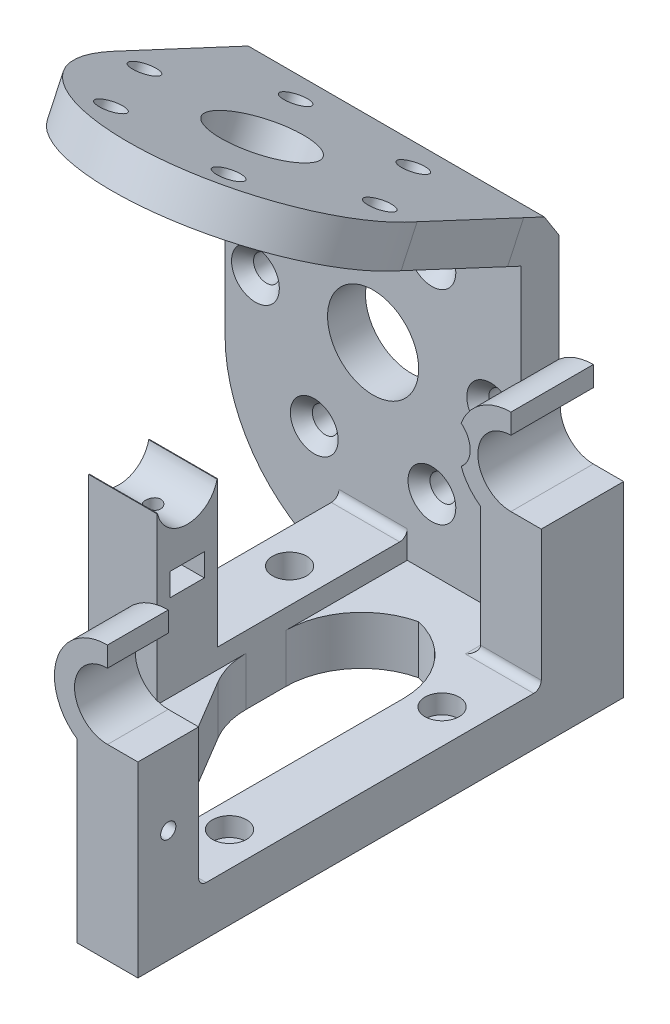
from build123d import *

# Parameters (mm, degrees)
SKETCH5_R                                       = 19.5
SKETCH5_R_2                                     = 1.5
SKETCH5_R_3                                     = 6
BOSS_EXTRUDE1_DEPTH                             = 5
CSK_FOR_M3_FLAT_HEAD_MACHINE_SCREW1_D           = 3.4
CSK_FOR_M3_FLAT_HEAD_MACHINE_SCREW1_CSINK_D     = 6.3
CSK_FOR_M3_FLAT_HEAD_MACHINE_SCREW1_CSINK_ANGLE = 90
BOSS_EXTRUDE2_START                             = -5
BOSS_EXTRUDE2_DEPTH                             = 5
SKETCH9_W                                       = 9
SKETCH9_H                                       = 5
BOSS_EXTRUDE3_DEPTH                             = 32.98166783
SKETCH10_W                                      = 9
SKETCH10_H                                      = 8
BOSS_EXTRUDE4_DEPTH                             = 24
CUT_EXTRUDE1_DEPTH                              = 20
SKETCH12_R                                      = 1
CUT_EXTRUDE2_DEPTH                              = 16
CUT_EXTRUDE3_START                              = -9
SKETCH13_W                                      = 4.5
SKETCH13_H                                      = 3
CUT_EXTRUDE3_DEPTH                              = 9
BOSS_EXTRUDE5_DEPTH                             = 2.4
SKETCH15_W                                      = 8
SKETCH15_H                                      = 26.6
BOSS_EXTRUDE6_DEPTH                             = 8
CUT_EXTRUDE4_REACH                              = 76.201
CUT_EXTRUDE5_REACH                              = 83.567
SKETCH17_W                                      = 8
SKETCH17_H                                      = 3
BOSS_EXTRUDE7_DEPTH                             = 2.4
FILLET1_R                                       = 10
FILLET2_R                                       = 1
FILLET3_R                                       = 1
BOSS_EXTRUDE8_START                             = -5.858134929
BOSS_EXTRUDE8_DEPTH                             = 5.858134929
BOSS_EXTRUDE9_DEPTH                             = 8
CUT_EXTRUDE9_REACH                              = 77.385
SKETCH26_R                                      = 4.35
BOSS_EXTRUDE10_START                            = 4
BOSS_EXTRUDE10_DEPTH                            = 4
SKETCH28_R                                      = 1
CUT_EXTRUDE10_DEPTH                             = 83.645869552
SKETCH29_R                                      = 2.25
CUT_EXTRUDE11_DEPTH                             = 2.5
SKETCH30_R                                      = 1
CUT_EXTRUDE12_DEPTH                             = 82.352195754
SKETCH31_R                                      = 2.25
CUT_EXTRUDE13_DEPTH                             = 5
CIRPATTERN1_START                               = 14.620394441
CIRPATTERN1_OUTLINE_R                           = 19.5
CIRPATTERN1_OUTLINE_R_2                         = 1.7
CIRPATTERN1_OUTLINE_R_3                         = 6
CIRPATTERN1_DEPTH                               = 5
BOSS_EXTRUDE11_START                            = -5
SKETCH32_R                                      = 4.35
BOSS_EXTRUDE11_DEPTH                            = 5
CUT_EXTRUDE14_REACH                             = 83.129
FILLET5_R                                       = 20
BOSS_EXTRUDE12_DEPTH                            = 39
BOSS_EXTRUDE13_START                            = -5
BOSS_EXTRUDE13_DEPTH                            = 5
BOSS_EXTRUDE14_START                            = -5
BOSS_EXTRUDE14_DEPTH                            = 5
SKETCH37_W                                      = 24.556153246
SKETCH37_H                                      = 66.139023171
CUT_EXTRUDE15_DEPTH                             = 24.65
SKETCH38_R                                      = 1
CUT_EXTRUDE16_DEPTH                             = 31


with BuildPart() as part:
    # Sketch5 → Boss-Extrude1 (new body)
    with BuildSketch(Plane.XY):
        Circle(SKETCH5_R)
        with Locations((-7.75, 13.423393759)):
            Circle(SKETCH5_R_2, mode=Mode.SUBTRACT)
        Circle(SKETCH5_R_3, mode=Mode.SUBTRACT)
        with Locations((7.75, 13.423393759)):
            Circle(SKETCH5_R_2, mode=Mode.SUBTRACT)
        with Locations((15.5, 0)):
            Circle(SKETCH5_R_2, mode=Mode.SUBTRACT)
        with Locations((7.75, -13.423393759)):
            Circle(SKETCH5_R_2, mode=Mode.SUBTRACT)
        with Locations((-7.75, -13.423393759)):
            Circle(SKETCH5_R_2, mode=Mode.SUBTRACT)
        with Locations((-15.5, 0)):
            Circle(SKETCH5_R_2, mode=Mode.SUBTRACT)
    extrude(amount=BOSS_EXTRUDE1_DEPTH)

    # CSK for M3 Flat Head Machine Screw1 (through all)
    with Locations(Plane.XY.offset(5)):
        with Locations((-15.5, 0), (-7.75, 13.423393759), (7.75, 13.423393759), (15.5, 0), (7.75, -13.423393759), (-7.75, -13.423393759)):
            CounterSinkHole(CSK_FOR_M3_FLAT_HEAD_MACHINE_SCREW1_D / 2, CSK_FOR_M3_FLAT_HEAD_MACHINE_SCREW1_CSINK_D / 2, counter_sink_angle=CSK_FOR_M3_FLAT_HEAD_MACHINE_SCREW1_CSINK_ANGLE)

    # Sketch8 → Boss-Extrude2 (add)
    with BuildSketch(Plane.XY.offset(5).offset(BOSS_EXTRUDE2_START)):
        with BuildLine():
            Line((-19.5, 0), (-19.5, -25))
            Line((-19.5, -25), (19.5, -25))
            Line((19.5, -25), (19.5, 0))
            ThreePointArc((19.5, 0), (0, -19.5), (-19.5, 0))
        make_face()
    extrude(amount=BOSS_EXTRUDE2_DEPTH)

    # Sketch9 → Boss-Extrude3 (add)
    with BuildSketch(Plane.XY.offset(5)):
        with Locations((0, -22.5)):
            Rectangle(SKETCH9_W, SKETCH9_H)
    extrude(amount=BOSS_EXTRUDE3_DEPTH)

    # Sketch10 → Boss-Extrude4 (add)
    with BuildSketch(Plane(origin=(0.371235249, -20, 0), x_dir=(1, 0, 0), z_dir=(0, 1, 0))):
        with Locations((-0.371235249, -33.98166783)):
            Rectangle(SKETCH10_W, SKETCH10_H)
    extrude(amount=BOSS_EXTRUDE4_DEPTH)

    # Sketch11 → Cut-Extrude1 (cut)
    with BuildSketch(Plane.ZY.offset(4.5)):
        with BuildLine():
            Line((29.98166783, 0), (27.136883472, 2.082164772))
            Line((27.136883472, 2.082164772), (27.357366889, 4.848229459))
            Line((27.357366889, 4.848229459), (32.749188635, 5.469591817))
            Line((32.749188635, 5.469591817), (41.448261638, 5.028624983))
            Line((41.448261638, 5.028624983), (40.823718291, 2.383004911))
            Line((40.823718291, 2.383004911), (37.98166783, 0))
            Line((37.98166783, 0), (37.98166783, -0.8))
            Line((37.98166783, -0.8), (37.900851418, -0.8))
            ThreePointArc((37.900851418, -0.8), (33.98166783, -4), (30.062484242, -0.8))
            Line((30.062484242, -0.8), (29.98166783, -0.8))
            Line((29.98166783, -0.8), (29.98166783, 0))
        make_face()
    extrude(amount=-CUT_EXTRUDE1_DEPTH, mode=Mode.SUBTRACT)

    # Sketch12 → Cut-Extrude2 (cut)
    with BuildSketch(Plane(origin=(0, -0.8, 0), x_dir=(1, 0, 0), z_dir=(0, 1, 0))):
        with Locations(Location((0, -33.98166783, 0), (0, 0, 180))):
            Circle(SKETCH12_R)
    extrude(amount=-CUT_EXTRUDE2_DEPTH, mode=Mode.SUBTRACT)

    # Sketch13 → Cut-Extrude3 (cut)
    with BuildSketch(Plane.ZY.offset(4.5).offset(CUT_EXTRUDE3_START)):
        with Locations((33.98166783, -9.74430731)):
            Rectangle(SKETCH13_W, SKETCH13_H)
    extrude(amount=CUT_EXTRUDE3_DEPTH, mode=Mode.SUBTRACT)

    # Sketch14 → Boss-Extrude5 (add)
    with BuildSketch(Plane.XZ.offset(25)):
        Polygon((4.5, 5), (28.014992407, 5), (28.014992407, 12.492055485), (28.014992407, 64), (20.014992407, 64), (20.014992407, 11), (4.5, 11), align=None)
    extrude(amount=-BOSS_EXTRUDE5_DEPTH)

    # Sketch15 → Boss-Extrude6 (add)
    with BuildSketch(Plane(origin=(28.014992407, 0, 0), x_dir=(0, 0, -1), z_dir=(1, 0, 0))):
        with Locations((-60, -9.3)):
            Rectangle(SKETCH15_W, SKETCH15_H)
        with Locations((-9, -9.3)):
            Rectangle(SKETCH15_W, SKETCH15_H)
    extrude(amount=-BOSS_EXTRUDE6_DEPTH)

    # Cut-Extrude4: up to this face of the body (flat: up to its plane)
    cut_extrude4_end = Plane(part.part.faces().sort_by_distance((12, -22.008286387, 5))[0])
    # Sketch16 → Cut-Extrude4 (cut, up to the picked face)
    with BuildSketch(Plane.XY.offset(64), mode=Mode.PRIVATE) as cut_extrude4_sk1:
        with BuildLine():
            Line((20.014992407, -1.0579315), (20.157430879, -1.0579315))
            ThreePointArc((20.157430879, -1.0579315), (24.014992407, -4), (27.872553935, -1.0579315))
            Line((27.872553935, -1.0579315), (28.014992407, -1.0579315))
            Line((28.014992407, -1.0579315), (30.979685938, 0.908889408))
            Line((30.979685938, 0.908889408), (30.041869507, 7.8055779))
            Line((30.041869507, 7.8055779), (20.014992407, 9.247594016))
            Line((20.014992407, 9.247594016), (20.014992407, -1.0579315))
        make_face()
    cut_extrude4_tool1 = split(extrude(cut_extrude4_sk1.sketch, amount=-CUT_EXTRUDE4_REACH, mode=Mode.PRIVATE), bisect_by=cut_extrude4_end, keep=Keep.BOTH, mode=Mode.PRIVATE)
    add(cut_extrude4_tool1.solids().sort_by(Axis((24.887523, 2.893806, 64), (0, 0, -1)))[0], mode=Mode.SUBTRACT)

    # Cut-Extrude5: up to this face of the body (flat: up to its plane)
    cut_extrude5_end = Plane(part.part.faces().sort_by_distance((20.086211643, -1.0579315, 9))[0])
    # Sketch17 → Cut-Extrude5 (cut, up to the picked face)
    with BuildSketch(Plane(origin=(0, -22.6, 0), x_dir=(1, 0, 0), z_dir=(0, 1, 0)), mode=Mode.PRIVATE) as cut_extrude5_sk1:
        with Locations((24.014992407, -12.358134929)):
            Rectangle(SKETCH17_W, SKETCH17_H)
    cut_extrude5_tool1 = split(extrude(cut_extrude5_sk1.sketch, amount=CUT_EXTRUDE5_REACH, mode=Mode.PRIVATE), bisect_by=cut_extrude5_end, keep=Keep.BOTH, mode=Mode.PRIVATE)
    add(cut_extrude5_tool1.solids().sort_by(Axis((24.014992, -22.6, 12.358135), (0, 1, 0)))[0], mode=Mode.SUBTRACT)

    # Sketch20 → Boss-Extrude7 (add)
    with BuildSketch(Plane(origin=(0, -22.6, 0), x_dir=(1, 0, 0), z_dir=(0, 1, 0))):
        Polygon((20.014992407, -64), (4.5, -37.98166783), (4.5, -28.98166783), (20.014992407, -55), align=None)
    extrude(amount=-BOSS_EXTRUDE7_DEPTH)

    # Fillet1
    # the kernel refuses this fillet: 10 mm, written as the material it adds along each edge
    with BuildSketch(Plane(origin=(4.5, -25, 11), x_dir=(0, 0, 1), z_dir=(0, 1, 0)), Plane(origin=(20.014992407, -25, 11), x_dir=(-1, 0, 0), z_dir=(0, 1, 0))) as fillet1_piece_1:
        with BuildLine():
            CenterArc((FILLET1_R, FILLET1_R), FILLET1_R, 180, 90)
            Line((0, FILLET1_R), (0, 0))
            Line((0, 0), (FILLET1_R, 0))
        make_face()
    extrude(amount=2.4)
    with BuildSketch(Plane(origin=(4.5, -22.6, 28.98166783), x_dir=(0, 0, -1), z_dir=(0, -1, 0))) as fillet1_piece_2:
        with BuildLine():
            CenterArc((FILLET1_R * 0.275521450238, FILLET1_R), FILLET1_R, 239.191952284, 30.808047716)
            Line((-FILLET1_R * 0.236642058357, FILLET1_R * 0.141112032647), (0, 0))
            Line((0, 0), (FILLET1_R * 0.275521450238, 0))
        make_face()
    extrude(amount=2.4)

    # Fillet2
    fillet2_edges = [part.edges().sort_by_distance(p)[0] for p in [
        (20.014992407, -23.8, 55),
    ]]
    fillet(fillet2_edges, radius=FILLET2_R)

    # Fillet3
    # the kernel refuses this fillet: 1 mm, written as the material it adds along each edge
    with BuildSketch(Plane(origin=(28.014992407, -22.6, 56), x_dir=(0, 0, -1), z_dir=(-1, 0, 0))) as fillet3_piece_1:
        with BuildLine():
            CenterArc((FILLET3_R, -FILLET3_R), FILLET3_R, 90, 90)
            Line((0, -FILLET3_R), (0, 0))
            Line((0, 0), (FILLET3_R, 0))
        make_face()
    extrude(amount=8)
    with BuildSketch(Plane(origin=(20.014992407, -22.6, 5), x_dir=(-1, 0, 0), z_dir=(0, 0, 1))) as fillet3_piece_2:
        with BuildLine():
            CenterArc((FILLET3_R, -FILLET3_R), FILLET3_R, 90, 90)
            Line((0, -FILLET3_R), (0, 0))
            Line((0, 0), (FILLET3_R, 0))
        make_face()
    extrude(amount=5.858134929)
    with BuildSketch(Plane(origin=(28.014992407, -22.6, 10.858134929), x_dir=(0, 0, 1), z_dir=(-1, 0, 0))) as fillet3_piece_3:
        with BuildLine():
            CenterArc((FILLET3_R, FILLET3_R), FILLET3_R, 180, 90)
            Line((0, FILLET3_R), (0, 0))
            Line((0, 0), (FILLET3_R, 0))
        make_face()
    extrude(amount=8)
    with BuildSketch(Plane(origin=(4.5, -20, 5), x_dir=(0, 1, 0), z_dir=(-1, 0, 0))) as fillet3_piece_4:
        with BuildLine():
            CenterArc((FILLET3_R, -FILLET3_R), FILLET3_R, 90, 90)
            Line((0, -FILLET3_R), (0, 0))
            Line((0, 0), (FILLET3_R, 0))
        make_face()
    extrude(amount=9)
    with BuildSketch(Plane(origin=(20.014992407, -22.6, 5), x_dir=(-1, 0, 0), z_dir=(0, 0, 1))) as fillet3_piece_5a_section:
        with BuildLine():
            CenterArc((FILLET3_R, -FILLET3_R), FILLET3_R, 90, 90)
            Line((0, -FILLET3_R), (0, 0))
            Line((0, 0), (FILLET3_R, 0))
        make_face()
    fillet3_piece_5a = extrude(amount=8.358134929, mode=Mode.PRIVATE)
    fillet3_piece_5a = split(fillet3_piece_5a, bisect_by=Plane(origin=(20.014992407, -22.6, 10.858134929), z_dir=(0, 0, 1)), keep=Keep.TOP, mode=Mode.PRIVATE)
    with BuildSketch(Plane(origin=(28.014992407, -22.6, 10.858134929), x_dir=(0, 0, 1), z_dir=(-1, 0, 0))) as fillet3_piece_5b_section:
        with BuildLine():
            CenterArc((FILLET3_R, FILLET3_R), FILLET3_R, 180, 90)
            Line((0, FILLET3_R), (0, 0))
            Line((0, 0), (FILLET3_R, 0))
        make_face()
    fillet3_piece_5b = extrude(amount=10.5, mode=Mode.PRIVATE)
    fillet3_piece_5b = split(fillet3_piece_5b, bisect_by=Plane(origin=(20.014992407, -22.6, 10.858134929), z_dir=(-1, 0, 0)), keep=Keep.TOP, mode=Mode.PRIVATE)
    fillet3_piece_5 = fillet3_piece_5a & fillet3_piece_5b
    add(fillet3_piece_5)

    # Sketch24 → Boss-Extrude8 (add)
    with BuildSketch(Plane(origin=(0, 0, 5), x_dir=(-1, 0, 0), z_dir=(0, 0, -1)).offset(BOSS_EXTRUDE8_START)):
        with BuildLine():
            Line((-20.014992407, -5.744562647), (-20.014992407, -1.0579315))
            Line((-20.014992407, -1.0579315), (-20.157430879, -1.0579315))
            ThreePointArc((-20.157430879, -1.0579315), (-24.014992407, 4), (-27.872553935, -1.0579315))
            Line((-27.872553935, -1.0579315), (-28.014992407, -1.0579315))
            Line((-28.014992407, -1.0579315), (-28.014992407, -5.744562647))
            ThreePointArc((-28.014992407, -5.744562647), (-28.312909665, 5.525206534), (-17.462867029, 2.463666582))
            ThreePointArc((-17.462867029, 2.463666582), (-18.65, 0), (-17.462867029, -2.463666582))
            ThreePointArc((-17.462867029, -2.463666582), (-18.489785873, -4.297917258), (-20.014992407, -5.744562647))
        make_face()
    extrude(amount=BOSS_EXTRUDE8_DEPTH)

    # Sketch25 → Boss-Extrude9 (add)
    with BuildSketch(Plane.XY.offset(64)):
        with BuildLine():
            Line((20.014992407, -5.744562647), (20.014992407, -1.0579315))
            Line((20.014992407, -1.0579315), (20.157430879, -1.0579315))
            ThreePointArc((20.157430879, -1.0579315), (24.014992407, 4), (27.872553935, -1.0579315))
            Line((27.872553935, -1.0579315), (28.014992407, -1.0579315))
            Line((28.014992407, -1.0579315), (28.014992407, -5.744562647))
            ThreePointArc((28.014992407, -5.744562647), (24.014992407, 7), (20.014992407, -5.744562647))
        make_face()
    extrude(amount=-BOSS_EXTRUDE9_DEPTH)

    # Cut-Extrude9: up to this face of the body (flat: up to its plane)
    cut_extrude9_end = Plane(part.part.faces().sort_by_distance((24.401043924, -10.02174873, 5))[0])
    # Sketch26 → Cut-Extrude9 (cut, up to the picked face)
    with BuildSketch(Plane.XY.offset(64), mode=Mode.PRIVATE) as cut_extrude9_sk1:
        with Locations((24.014992407, 0)):
            Circle(SKETCH26_R)
    cut_extrude9_tool1 = split(extrude(cut_extrude9_sk1.sketch, amount=-CUT_EXTRUDE9_REACH, mode=Mode.PRIVATE), bisect_by=cut_extrude9_end, keep=Keep.BOTH, mode=Mode.PRIVATE)
    add(cut_extrude9_tool1.solids().sort_by(Axis((24.014992, 0, 64), (0, 0, -1)))[0], mode=Mode.SUBTRACT)

    # Sketch27 → Boss-Extrude10 (add)
    with BuildSketch(Plane.XZ.offset(25).offset(BOSS_EXTRUDE10_START)):
        Polygon((19.5, 0), (19.5, 5), (28.014992407, 5), (28.014992407, 64), (20.014992407, 64), (4.5, 37.98166783), (-4.5, 37.98166783), (-4.5, 5), (-19.5, 5), (-19.5, 0), align=None)
        with BuildLine():
            Line((4.5, 26.226453328), (4.5, 21))
            ThreePointArc((4.5, 21), (6.67615702, 14.772040381), (12.257496204, 11.25468437))
            ThreePointArc((12.257496204, 11.25468437), (17.838835387, 14.772040381), (20.014992407, 21))
            Line((20.014992407, 21), (20.014992407, 51.370518524))
            ThreePointArc((20.014992407, 51.370518524), (19.280616232, 52.334595276), (18.15610444, 51.882682032))
            Line((18.15610444, 51.882682032), (5.911120326, 31.348088414))
            ThreePointArc((5.911120326, 31.348088414), (4.85923248, 28.882691576), (4.5, 26.226453328))
        make_face(mode=Mode.SUBTRACT)
    extrude(amount=-BOSS_EXTRUDE10_DEPTH)

    # Sketch28 → Cut-Extrude10 (cut, through all)
    with BuildSketch(Plane(origin=(0, -22.6, 0), x_dir=(1, 0, 0), z_dir=(0, 1, 0))):
        with Locations(Location((23.514992407, -19.429067464, 0), (0, 0, 270))):
            Circle(SKETCH28_R)
        with Locations(Location((23.514992407, -47.429067464, 0), (0, 0, 270))):
            Circle(SKETCH28_R)
    extrude(amount=-CUT_EXTRUDE10_DEPTH, mode=Mode.SUBTRACT)

    # Sketch29 → Cut-Extrude11 (cut)
    with BuildSketch(Plane(origin=(0, -22.6, 0), x_dir=(1, 0, 0), z_dir=(0, 1, 0))):
        with Locations(Location((23.514992407, -19.429067464, 0), (0, 0, 270))):
            Circle(SKETCH29_R)
        with Locations(Location((23.514992407, -47.429067464, 0), (0, 0, 270))):
            Circle(SKETCH29_R)
    extrude(amount=-CUT_EXTRUDE11_DEPTH, mode=Mode.SUBTRACT)

    # Sketch30 → Cut-Extrude12 (cut, through all)
    with BuildSketch(Plane(origin=(0, -20, 0), x_dir=(1, 0, 0), z_dir=(0, 1, 0))):
        with Locations(Location((0, -16, 0), (0, 0, 270))):
            Circle(SKETCH30_R)
    extrude(amount=-CUT_EXTRUDE12_DEPTH, mode=Mode.SUBTRACT)

    # Sketch31 → Cut-Extrude13 (cut)
    with BuildSketch(Plane(origin=(0, -20, 0), x_dir=(1, 0, 0), z_dir=(0, 1, 0))):
        with Locations(Location((0, -16, 0), (0, 0, 270))):
            Circle(SKETCH31_R)
    extrude(amount=-CUT_EXTRUDE13_DEPTH, mode=Mode.SUBTRACT)

    # CirPattern1: read off the stored shape, not the designer's step
    # CirPattern1 outline → CirPattern1 (add)
    with BuildSketch(Plane(origin=(0, 0, 0), x_dir=(1, 0, 0), z_dir=(0, 0.9063077870366512, -0.42261826174069705)).offset(CIRPATTERN1_START)):
        with Locations((0, -30.797850171)):
            Circle(CIRPATTERN1_OUTLINE_R)
        with Locations((-7.75, -44.221243929)):
            Circle(CIRPATTERN1_OUTLINE_R_2, mode=Mode.SUBTRACT)
        with Locations((7.75, -44.221243929)):
            Circle(CIRPATTERN1_OUTLINE_R_2, mode=Mode.SUBTRACT)
        with Locations((-15.5, -30.797850171)):
            Circle(CIRPATTERN1_OUTLINE_R_2, mode=Mode.SUBTRACT)
        with Locations((-7.75, -17.374456412)):
            Circle(CIRPATTERN1_OUTLINE_R_2, mode=Mode.SUBTRACT)
        with Locations((0, -30.797850171)):
            Circle(CIRPATTERN1_OUTLINE_R_3, mode=Mode.SUBTRACT)
        with Locations((15.5, -30.797850171)):
            Circle(CIRPATTERN1_OUTLINE_R_2, mode=Mode.SUBTRACT)
        with Locations((7.75, -17.374456412)):
            Circle(CIRPATTERN1_OUTLINE_R_2, mode=Mode.SUBTRACT)
    extrude(amount=CIRPATTERN1_DEPTH)

    # CirPattern1 2: loft between two sections, ruled curve by curve
    cirpattern1_2_from = [
        Edge.make_three_point_arc((-7.75, 21.189035145, 7.41423974), (-6.05, 21.90748619, 8.954962978), (-7.75, 22.625937235, 10.495686216)),
        Edge.make_three_point_arc((-7.75, 22.625937235, 10.495686216), (-9.45, 21.90748619, 8.954962978), (-7.75, 21.189035145, 7.41423974)),
    ]
    cirpattern1_2_to = [
        Edge.make_three_point_arc((-7.75, 19.262092374, 6.712889928), (-4.6, 20.593339899, 9.567759457), (-7.75, 21.924587423, 12.422628987)),
        Edge.make_three_point_arc((-7.75, 21.924587423, 12.422628987), (-10.9, 20.593339899, 9.567759457), (-7.75, 19.262092374, 6.712889928)),
    ]
    cirpattern1_2 = Solid(Shell([*[Face.make_surface_from_curves(cirpattern1_2_from[k], cirpattern1_2_to[k]) for k in range(2)], Face(Wire(cirpattern1_2_from)), Face(Wire(cirpattern1_2_to))]))
    add(cirpattern1_2, mode=Mode.SUBTRACT)

    # CirPattern1 3: loft between two sections, ruled curve by curve
    cirpattern1_3_from = [
        Edge.make_three_point_arc((7.75, 21.189035145, 7.41423974), (9.45, 21.90748619, 8.954962978), (7.75, 22.625937235, 10.495686216)),
        Edge.make_three_point_arc((7.75, 22.625937235, 10.495686216), (6.05, 21.90748619, 8.954962978), (7.75, 21.189035145, 7.41423974)),
    ]
    cirpattern1_3_to = [
        Edge.make_three_point_arc((7.75, 19.262092374, 6.712889928), (10.9, 20.593339899, 9.567759457), (7.75, 21.924587423, 12.422628987)),
        Edge.make_three_point_arc((7.75, 21.924587423, 12.422628987), (4.6, 20.593339899, 9.567759457), (7.75, 19.262092374, 6.712889928)),
    ]
    cirpattern1_3 = Solid(Shell([*[Face.make_surface_from_curves(cirpattern1_3_from[k], cirpattern1_3_to[k]) for k in range(2)], Face(Wire(cirpattern1_3_from)), Face(Wire(cirpattern1_3_to))]))
    add(cirpattern1_3, mode=Mode.SUBTRACT)

    # CirPattern1 4: loft between two sections, ruled curve by curve
    cirpattern1_4_from = [
        Edge.make_three_point_arc((15.5, 26.862006482, 19.579966032), (17.2, 27.580457527, 21.12068927), (15.5, 28.298908572, 22.661412508)),
        Edge.make_three_point_arc((15.5, 28.298908572, 22.661412508), (13.8, 27.580457527, 21.12068927), (15.5, 26.862006482, 19.579966032)),
    ]
    cirpattern1_4_to = [
        Edge.make_three_point_arc((15.5, 24.935063711, 18.87861622), (18.65, 26.266311236, 21.733485749), (15.5, 27.59755876, 24.588355279)),
        Edge.make_three_point_arc((15.5, 27.59755876, 24.588355279), (12.35, 26.266311236, 21.733485749), (15.5, 24.935063711, 18.87861622)),
    ]
    cirpattern1_4 = Solid(Shell([*[Face.make_surface_from_curves(cirpattern1_4_from[k], cirpattern1_4_to[k]) for k in range(2)], Face(Wire(cirpattern1_4_from)), Face(Wire(cirpattern1_4_to))]))
    add(cirpattern1_4, mode=Mode.SUBTRACT)

    # CirPattern1 5: loft between two sections, ruled curve by curve
    cirpattern1_5_from = [
        Edge.make_three_point_arc((7.75, 32.534977819, 31.745692324), (9.45, 33.253428864, 33.286415562), (7.75, 33.971879909, 34.8271388)),
        Edge.make_three_point_arc((7.75, 33.971879909, 34.8271388), (6.05, 33.253428864, 33.286415562), (7.75, 32.534977819, 31.745692324)),
    ]
    cirpattern1_5_to = [
        Edge.make_three_point_arc((7.75, 30.608035048, 31.044342512), (10.9, 31.939282573, 33.899212041), (7.75, 33.270530097, 36.75408157)),
        Edge.make_three_point_arc((7.75, 33.270530097, 36.75408157), (4.6, 31.939282573, 33.899212041), (7.75, 30.608035048, 31.044342512)),
    ]
    cirpattern1_5 = Solid(Shell([*[Face.make_surface_from_curves(cirpattern1_5_from[k], cirpattern1_5_to[k]) for k in range(2)], Face(Wire(cirpattern1_5_from)), Face(Wire(cirpattern1_5_to))]))
    add(cirpattern1_5, mode=Mode.SUBTRACT)

    # CirPattern1 6: loft between two sections, ruled curve by curve
    cirpattern1_6_from = [
        Edge.make_three_point_arc((-7.75, 32.534977819, 31.745692324), (-6.05, 33.253428864, 33.286415562), (-7.75, 33.971879909, 34.8271388)),
        Edge.make_three_point_arc((-7.75, 33.971879909, 34.8271388), (-9.45, 33.253428864, 33.286415562), (-7.75, 32.534977819, 31.745692324)),
    ]
    cirpattern1_6_to = [
        Edge.make_three_point_arc((-7.75, 30.608035048, 31.044342512), (-4.6, 31.939282573, 33.899212041), (-7.75, 33.270530097, 36.75408157)),
        Edge.make_three_point_arc((-7.75, 33.270530097, 36.75408157), (-10.9, 31.939282573, 33.899212041), (-7.75, 30.608035048, 31.044342512)),
    ]
    cirpattern1_6 = Solid(Shell([*[Face.make_surface_from_curves(cirpattern1_6_from[k], cirpattern1_6_to[k]) for k in range(2)], Face(Wire(cirpattern1_6_from)), Face(Wire(cirpattern1_6_to))]))
    add(cirpattern1_6, mode=Mode.SUBTRACT)

    # CirPattern1 7: loft between two sections, ruled curve by curve
    cirpattern1_7_from = [
        Edge.make_three_point_arc((-15.5, 26.862006482, 19.579966032), (-13.8, 27.580457527, 21.12068927), (-15.5, 28.298908572, 22.661412508)),
        Edge.make_three_point_arc((-15.5, 28.298908572, 22.661412508), (-17.2, 27.580457527, 21.12068927), (-15.5, 26.862006482, 19.579966032)),
    ]
    cirpattern1_7_to = [
        Edge.make_three_point_arc((-15.5, 24.935063711, 18.87861622), (-12.35, 26.266311236, 21.733485749), (-15.5, 27.59755876, 24.588355279)),
        Edge.make_three_point_arc((-15.5, 27.59755876, 24.588355279), (-18.65, 26.266311236, 21.733485749), (-15.5, 24.935063711, 18.87861622)),
    ]
    cirpattern1_7 = Solid(Shell([*[Face.make_surface_from_curves(cirpattern1_7_from[k], cirpattern1_7_to[k]) for k in range(2)], Face(Wire(cirpattern1_7_from)), Face(Wire(cirpattern1_7_to))]))
    add(cirpattern1_7, mode=Mode.SUBTRACT)

    # Sketch32 → Boss-Extrude11 (add)
    with BuildSketch(Plane(origin=(0, 0, 0), x_dir=(-1, 0, 0), z_dir=(0, 0, -1)).offset(BOSS_EXTRUDE11_START)):
        with BuildLine():
            Line((-19.5, 0), (-19.5, -29))
            Line((-19.5, -29), (-28.014992407, -29))
            Line((-28.014992407, -29), (-28.014992407, -5.744562647))
            ThreePointArc((-28.014992407, -5.744562647), (-29.308148463, 4.580665778), (-18.904229594, 4.783315113))
            ThreePointArc((-18.904229594, 4.783315113), (-19.350484194, 2.410137229), (-19.5, 0))
        make_face()
        with Locations(Location((-24.014992407, 0, 0), (0, 0, 180))):
            Circle(SKETCH32_R, mode=Mode.SUBTRACT)
    extrude(amount=BOSS_EXTRUDE11_DEPTH)

    # Cut-Extrude14: up to this face of the body (flat: up to its plane)
    cut_extrude14_end = Plane(part.part.faces().sort_by_distance((24.014992407, -9.62038497, 64))[0])
    # Sketch33 → Cut-Extrude14 (cut, up to the picked face)
    with BuildSketch(Plane(origin=(0, 0, 0), x_dir=(-1, 0, 0), z_dir=(0, 0, -1)), mode=Mode.PRIVATE) as cut_extrude14_sk1:
        Polygon((-24.014992407, 0), (-24.014992407, 7), (-32.443341216, 7), (-32.443341216, -4.35), (-24.014992407, -4.35), align=None)
    cut_extrude14_tool1 = split(extrude(cut_extrude14_sk1.sketch, amount=-CUT_EXTRUDE14_REACH, mode=Mode.PRIVATE), bisect_by=cut_extrude14_end, keep=Keep.BOTH, mode=Mode.PRIVATE)
    add(cut_extrude14_tool1.solids().sort_by(Axis((28.229167, 1.325, 0), (0, 0, 1)))[0], mode=Mode.SUBTRACT)

    # Fillet5
    # the kernel refuses this fillet: 20 mm, written as the material it takes off along each edge
    with BuildSketch(Plane(origin=(-19.5, -29, 55), x_dir=(0, 1, 0), z_dir=(0, 0, -1))) as fillet5_piece_1:
        with BuildLine():
            CenterArc((FILLET5_R, FILLET5_R), FILLET5_R, 180, 90)
            Line((0, FILLET5_R), (0, 0))
            Line((0, 0), (FILLET5_R, 0))
        make_face()
    extrude(amount=105, mode=Mode.SUBTRACT)

    # Sketch34 → Boss-Extrude12 (add)
    with BuildSketch(Plane.ZY.offset(19.5)):
        Polygon((1.947392593, 22.556794067), (0, 19.5), (0, 16.5), (5, 16.5), (5, 18.463358683), (6.779407263, 19.293109917), (4.666315955, 23.824648852), align=None)
    extrude(amount=-BOSS_EXTRUDE12_DEPTH)

    # Sketch35 → Boss-Extrude13 (add)
    with BuildSketch(Plane(origin=(0, 0, 0), x_dir=(-1, 0, 0), z_dir=(0, 0, -1)).offset(BOSS_EXTRUDE13_START)):
        with BuildLine():
            Line((19.5, 16.5), (19.5, 0))
            ThreePointArc((19.5, 0), (17.071905935, 9.423376664), (10.392304845, 16.5))
            Line((10.392304845, 16.5), (19.5, 16.5))
        make_face()
        with BuildLine():
            Line((-19.5, 16.5), (-19.5, 5.349284397))
            ThreePointArc((-19.5, 5.349284397), (-19.193802596, 5.075049635), (-18.904229594, 4.783315113))
            ThreePointArc((-18.904229594, 4.783315113), (-15.776308463, 11.461155757), (-10.392304845, 16.5))
            Line((-10.392304845, 16.5), (-19.5, 16.5))
        make_face()
    extrude(amount=BOSS_EXTRUDE13_DEPTH)

    # Sketch36 → Boss-Extrude14 (add)
    with BuildSketch(Plane(origin=(0, 17.782116266, -8.291936993), x_dir=(1, 0, 0), z_dir=(0, 0.906307787036651, -0.4226182617406973)).offset(BOSS_EXTRUDE14_START)):
        with BuildLine():
            Line((-19.5, -14.297850171), (-19.5, -30.797850171))
            ThreePointArc((-19.5, -30.797850171), (-17.071905935, -21.374473507), (-10.392304845, -14.297850171))
            Line((-10.392304845, -14.297850171), (-19.5, -14.297850171))
        make_face()
        with BuildLine():
            Line((10.392304845, -14.297850171), (19.5, -14.297850171))
            Line((19.5, -14.297850171), (19.471347355, -29.741141987))
            ThreePointArc((19.471347355, -29.741141987), (16.810212557, -20.915201043), (10.392304845, -14.297850171))
        make_face()
    extrude(amount=BOSS_EXTRUDE14_DEPTH)

    # Sketch37 → Cut-Extrude15 (cut)
    with BuildSketch(Plane(origin=(0, -29, 0), x_dir=(-1, 0, 0), z_dir=(0, -1, 0))):
        with Locations((-40.29306903, -30.930488415)):
            Rectangle(SKETCH37_W, SKETCH37_H)
    extrude(amount=-CUT_EXTRUDE15_DEPTH, mode=Mode.SUBTRACT)

    # Sketch38 → Cut-Extrude16 (cut)
    with BuildSketch(Plane(origin=(28.014992407, 0, 0), x_dir=(0, 0, -1), z_dir=(1, 0, 0))):
        with Locations((-60, -14.172281323)):
            Circle(SKETCH38_R)
    extrude(amount=-CUT_EXTRUDE16_DEPTH, mode=Mode.SUBTRACT)


solid = part.part
